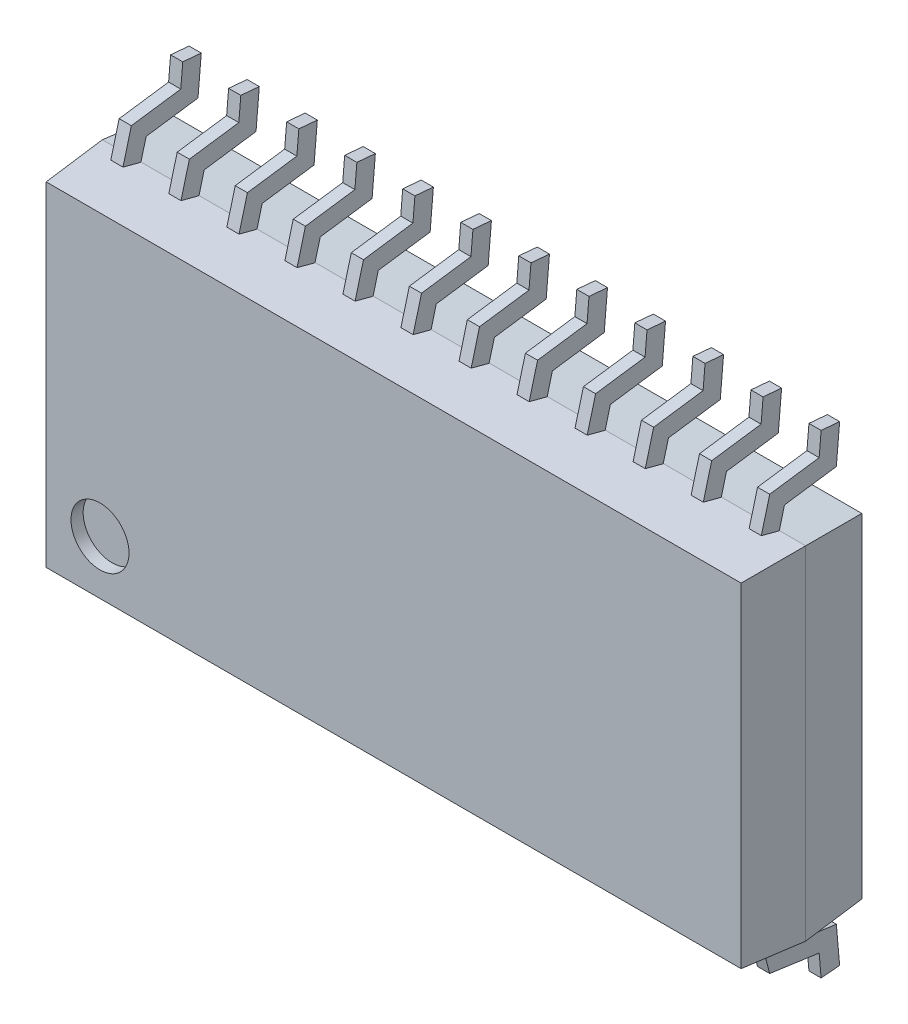
from build123d import *

# Parameters (mm, degrees)
SKETCH1_W             = 15.3924
SKETCH1_H             = 7.493
BOSS_EXTRUDE1_DEPTH   = 1.3208
BOSS_EXTRUDE1_TAPER   = 4
EXTRUDE_THIN4_DEPTH   = 0.13335
LPATTERN1_COUNT       = 12
LPATTERN1_PITCH       = 1.27
MIRROR2_COPY_1_DEPTH  = 0.13335
MIRROR2_COPY_2_DEPTH  = 0.13335
MIRROR2_COPY_3_DEPTH  = 0.13335
MIRROR2_COPY_4_DEPTH  = 0.13335
MIRROR2_COPY_5_DEPTH  = 0.13335
MIRROR2_COPY_6_DEPTH  = 0.13335
MIRROR2_COPY_7_DEPTH  = 0.13335
MIRROR2_COPY_8_DEPTH  = 0.13335
MIRROR2_COPY_9_DEPTH  = 0.13335
MIRROR2_COPY_10_DEPTH = 0.13335
MIRROR2_COPY_11_DEPTH = 0.13335
SKETCH5_R             = 0.635
CUT_EXTRUDE1_DEPTH    = 0.2667


with BuildPart() as part:
    # Sketch1 → Boss-Extrude1 (new body)
    with BuildSketch(Plane.XY):
        with Locations((7.6962, 3.7465)):
            Rectangle(SKETCH1_W, SKETCH1_H)
    boss_extrude1 = extrude(amount=BOSS_EXTRUDE1_DEPTH, taper=BOSS_EXTRUDE1_TAPER)

    # Mirror1: Boss-Extrude1 across plane
    add(boss_extrude1.mirror(Plane.XY))


with BuildPart() as body_2:
    # Sketch3 → Extrude-Thin4 (new, symmetric)
    with BuildSketch(Plane.ZY.offset(-0.7112)):
        Polygon((0, 0), (-0.114561451, -0.433188637), (-1.249178861, -0.593101158), (-1.3208, -1.4097), (-0.915954146, -1.445207669), (-0.872559482, -0.950437085), (0.209343918, -0.797954055), (0.392892806, -0.10390478), align=None)
    extrude_thin4 = extrude(amount=EXTRUDE_THIN4_DEPTH, both=True)


with BuildPart() as lpattern1_1:
    # LPattern1: Extrude-Thin4 ×12
    with Locations(*[(i * LPATTERN1_PITCH, 0, 0) for i in range(1, LPATTERN1_COUNT)]):
        add(extrude_thin4)


with BuildPart() as part_1:
    add(part.part)

    # Mirror2: Extrude-Thin4 across plane
    add(extrude_thin4.mirror(Plane.ZX.offset(3.74396)))

    # Mirror2 copy 1 sketch → Mirror2 copy 1 (add, symmetric)
    with BuildSketch(Plane(origin=(1.9812, 7.48792, 0), x_dir=(0, 0, 1), z_dir=(-1, 0, 0))):
        Polygon((0, 0), (-0.114561451, 0.433188637), (-1.249178861, 0.593101158), (-1.3208, 1.4097), (-0.915954146, 1.445207669), (-0.872559482, 0.950437085), (0.209343918, 0.797954055), (0.392892806, 0.10390478), align=None)
    extrude(amount=MIRROR2_COPY_1_DEPTH, both=True)

    # Mirror2 copy 2 sketch → Mirror2 copy 2 (add, symmetric)
    with BuildSketch(Plane(origin=(3.2512, 7.48792, 0), x_dir=(0, 0, 1), z_dir=(-1, 0, 0))):
        Polygon((0, 0), (-0.114561451, 0.433188637), (-1.249178861, 0.593101158), (-1.3208, 1.4097), (-0.915954146, 1.445207669), (-0.872559482, 0.950437085), (0.209343918, 0.797954055), (0.392892806, 0.10390478), align=None)
    extrude(amount=MIRROR2_COPY_2_DEPTH, both=True)

    # Mirror2 copy 3 sketch → Mirror2 copy 3 (add, symmetric)
    with BuildSketch(Plane(origin=(4.5212, 7.48792, 0), x_dir=(0, 0, 1), z_dir=(-1, 0, 0))):
        Polygon((0, 0), (-0.114561451, 0.433188637), (-1.249178861, 0.593101158), (-1.3208, 1.4097), (-0.915954146, 1.445207669), (-0.872559482, 0.950437085), (0.209343918, 0.797954055), (0.392892806, 0.10390478), align=None)
    extrude(amount=MIRROR2_COPY_3_DEPTH, both=True)

    # Mirror2 copy 4 sketch → Mirror2 copy 4 (add, symmetric)
    with BuildSketch(Plane(origin=(5.7912, 7.48792, 0), x_dir=(0, 0, 1), z_dir=(-1, 0, 0))):
        Polygon((0, 0), (-0.114561451, 0.433188637), (-1.249178861, 0.593101158), (-1.3208, 1.4097), (-0.915954146, 1.445207669), (-0.872559482, 0.950437085), (0.209343918, 0.797954055), (0.392892806, 0.10390478), align=None)
    extrude(amount=MIRROR2_COPY_4_DEPTH, both=True)

    # Mirror2 copy 5 sketch → Mirror2 copy 5 (add, symmetric)
    with BuildSketch(Plane(origin=(7.0612, 7.48792, 0), x_dir=(0, 0, 1), z_dir=(-1, 0, 0))):
        Polygon((0, 0), (-0.114561451, 0.433188637), (-1.249178861, 0.593101158), (-1.3208, 1.4097), (-0.915954146, 1.445207669), (-0.872559482, 0.950437085), (0.209343918, 0.797954055), (0.392892806, 0.10390478), align=None)
    extrude(amount=MIRROR2_COPY_5_DEPTH, both=True)

    # Mirror2 copy 6 sketch → Mirror2 copy 6 (add, symmetric)
    with BuildSketch(Plane(origin=(8.3312, 7.48792, 0), x_dir=(0, 0, 1), z_dir=(-1, 0, 0))):
        Polygon((0, 0), (-0.114561451, 0.433188637), (-1.249178861, 0.593101158), (-1.3208, 1.4097), (-0.915954146, 1.445207669), (-0.872559482, 0.950437085), (0.209343918, 0.797954055), (0.392892806, 0.10390478), align=None)
    extrude(amount=MIRROR2_COPY_6_DEPTH, both=True)

    # Mirror2 copy 7 sketch → Mirror2 copy 7 (add, symmetric)
    with BuildSketch(Plane(origin=(9.6012, 7.48792, 0), x_dir=(0, 0, 1), z_dir=(-1, 0, 0))):
        Polygon((0, 0), (-0.114561451, 0.433188637), (-1.249178861, 0.593101158), (-1.3208, 1.4097), (-0.915954146, 1.445207669), (-0.872559482, 0.950437085), (0.209343918, 0.797954055), (0.392892806, 0.10390478), align=None)
    extrude(amount=MIRROR2_COPY_7_DEPTH, both=True)

    # Mirror2 copy 8 sketch → Mirror2 copy 8 (add, symmetric)
    with BuildSketch(Plane(origin=(10.8712, 7.48792, 0), x_dir=(0, 0, 1), z_dir=(-1, 0, 0))):
        Polygon((0, 0), (-0.114561451, 0.433188637), (-1.249178861, 0.593101158), (-1.3208, 1.4097), (-0.915954146, 1.445207669), (-0.872559482, 0.950437085), (0.209343918, 0.797954055), (0.392892806, 0.10390478), align=None)
    extrude(amount=MIRROR2_COPY_8_DEPTH, both=True)

    # Mirror2 copy 9 sketch → Mirror2 copy 9 (add, symmetric)
    with BuildSketch(Plane(origin=(12.1412, 7.48792, 0), x_dir=(0, 0, 1), z_dir=(-1, 0, 0))):
        Polygon((0, 0), (-0.114561451, 0.433188637), (-1.249178861, 0.593101158), (-1.3208, 1.4097), (-0.915954146, 1.445207669), (-0.872559482, 0.950437085), (0.209343918, 0.797954055), (0.392892806, 0.10390478), align=None)
    extrude(amount=MIRROR2_COPY_9_DEPTH, both=True)

    # Mirror2 copy 10 sketch → Mirror2 copy 10 (add, symmetric)
    with BuildSketch(Plane(origin=(13.4112, 7.48792, 0), x_dir=(0, 0, 1), z_dir=(-1, 0, 0))):
        Polygon((0, 0), (-0.114561451, 0.433188637), (-1.249178861, 0.593101158), (-1.3208, 1.4097), (-0.915954146, 1.445207669), (-0.872559482, 0.950437085), (0.209343918, 0.797954055), (0.392892806, 0.10390478), align=None)
    extrude(amount=MIRROR2_COPY_10_DEPTH, both=True)

    # Mirror2 copy 11 sketch → Mirror2 copy 11 (add, symmetric)
    with BuildSketch(Plane(origin=(14.6812, 7.48792, 0), x_dir=(0, 0, 1), z_dir=(-1, 0, 0))):
        Polygon((0, 0), (-0.114561451, 0.433188637), (-1.249178861, 0.593101158), (-1.3208, 1.4097), (-0.915954146, 1.445207669), (-0.872559482, 0.950437085), (0.209343918, 0.797954055), (0.392892806, 0.10390478), align=None)
    extrude(amount=MIRROR2_COPY_11_DEPTH, both=True)

    # Sketch5 → Cut-Extrude1 (cut)
    with BuildSketch(Plane.XY.offset(1.3208)):
        with Locations((1.27, 1.27)):
            Circle(SKETCH5_R)
    extrude(amount=-CUT_EXTRUDE1_DEPTH, mode=Mode.SUBTRACT)


solid = Compound([body_2.part, lpattern1_1.part, part_1.part])
